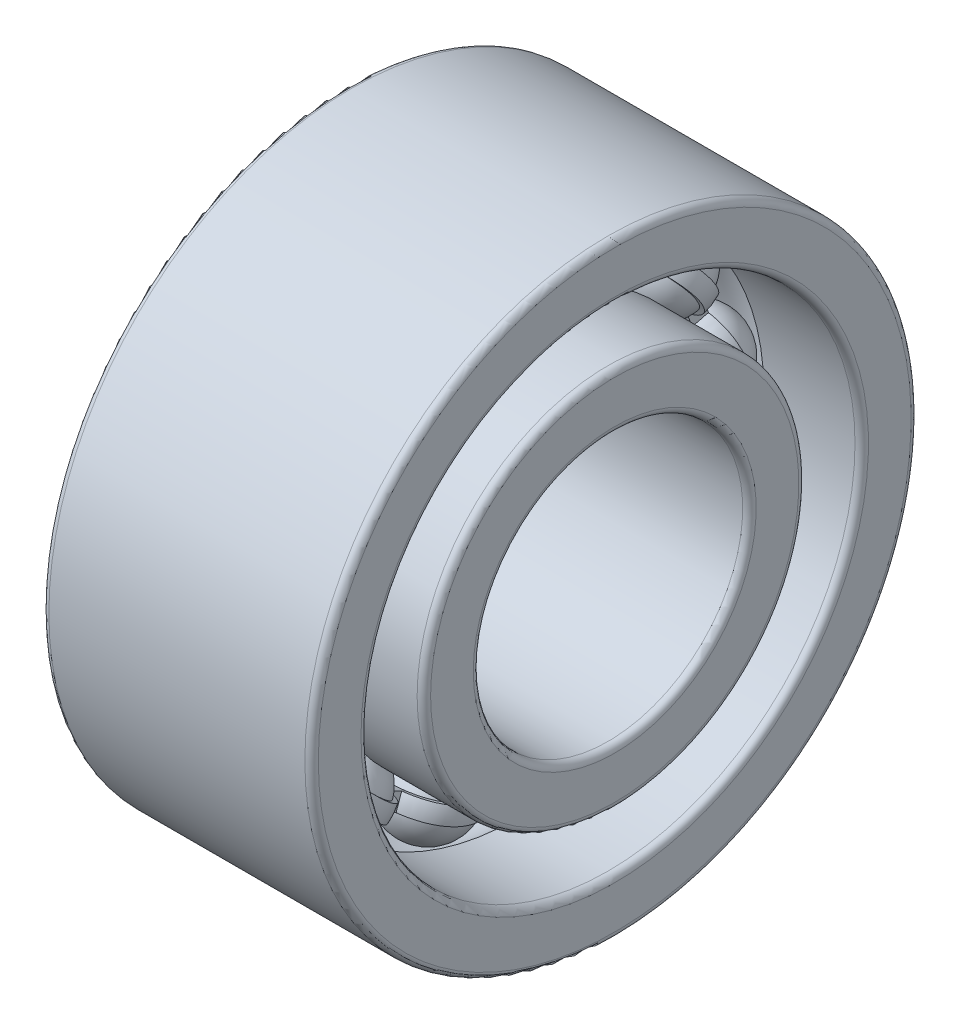
from build123d import *
from build123d.topology import SkipClean

# Parameters (mm, degrees)
SKETCH_5_W               = 0.375
SKETCH_5_H               = 0.25
PATTERN_CIRCULAR_5_COUNT = 13
PATTERN_CIRCULAR_2_COUNT = 13


with BuildPart() as part:
    # 草图2 → 旋转1 (revolve)
    with BuildSketch(Plane.XY, mode=Mode.PRIVATE) as revolve_1_sk:
        with BuildLine():
            Line((1.9, 2), (-1.9, 2))
            ThreePointArc((-1.9, 2), (-1.970710678, 2.029289322), (-2, 2.1))
            Line((-2, 2.1), (-2, 2.733333333))
            ThreePointArc((-2, 2.733333333), (-1.970710678, 2.804044011), (-1.9, 2.833333333))
            Line((-1.9, 2.833333333), (-0.465847495, 2.833333333))
            ThreePointArc((-0.465847495, 2.833333333), (0, 2.625), (0.465847495, 2.833333333))
            Line((0.465847495, 2.833333333), (1.9, 2.833333333))
            ThreePointArc((1.9, 2.833333333), (1.970710678, 2.804044011), (2, 2.733333333))
            Line((2, 2.733333333), (2, 2.1))
            ThreePointArc((2, 2.1), (1.970710678, 2.029289322), (1.9, 2))
        make_face()
        with BuildLine():
            Line((-2, 4.4), (-2, 3.766666667))
            ThreePointArc((-2, 3.766666667), (-1.970710678, 3.695955989), (-1.9, 3.666666667))
            Line((-1.9, 3.666666667), (-0.465847495, 3.666666667))
            ThreePointArc((-0.465847495, 3.666666667), (0, 3.875), (0.465847495, 3.666666667))
            Line((0.465847495, 3.666666667), (1.9, 3.666666667))
            ThreePointArc((1.9, 3.666666667), (1.970710678, 3.695955989), (2, 3.766666667))
            Line((2, 3.766666667), (2, 4.4))
            ThreePointArc((2, 4.4), (1.970710678, 4.470710678), (1.9, 4.5))
            Line((1.9, 4.5), (-1.9, 4.5))
            ThreePointArc((-1.9, 4.5), (-1.970710678, 4.470710678), (-2, 4.4))
        make_face()
    revolve(revolve_1_sk.sketch.rotate(Axis((-3.5, 0, 0), (1, 0, 0)), 90), axis=Axis((-3.5, 0, 0), (1, 0, 0)))


with BuildPart() as body_2:
    # 草图5 → 旋转3 (revolve)
    with BuildSketch(Plane.XY, mode=Mode.PRIVATE) as revolve_3_sk:
        with Locations((0, 3.25)):
            Rectangle(SKETCH_5_W, SKETCH_5_H)
    revolve(revolve_3_sk.sketch.rotate(Axis((-19.927092192, 0, 0), (1, 0, 0)), 90), axis=Axis((-19.927092192, 0, 0), (1, 0, 0)))



with BuildPart() as body_3:
    # 草图3 → 旋转2 (revolve)
    with BuildSketch(Plane.XY):
        with BuildLine():
            Line((-0.6875, 3.25), (0.6875, 3.25))
            ThreePointArc((0.6875, 3.25), (0, 3.9375), (-0.6875, 3.25))
        make_face()
    revolve(axis=Axis((-0.6875, 3.25, 0), (1, 0, 0)))


with BuildPart() as pattern_circular_5_1:
    # 阵列(圆周)5: pattern copy
    add(body_3.part.rotate(Axis((0, 0, 0), (1, 0, 0)), 1 * 360 / PATTERN_CIRCULAR_5_COUNT))


with BuildPart() as pattern_circular_5_2:
    # 阵列(圆周)5: pattern copy
    add(body_3.part.rotate(Axis((0, 0, 0), (1, 0, 0)), 2 * 360 / PATTERN_CIRCULAR_5_COUNT))


with BuildPart() as pattern_circular_5_3:
    # 阵列(圆周)5: pattern copy
    add(body_3.part.rotate(Axis((0, 0, 0), (1, 0, 0)), 3 * 360 / PATTERN_CIRCULAR_5_COUNT))


with BuildPart() as pattern_circular_5_4:
    # 阵列(圆周)5: pattern copy
    add(body_3.part.rotate(Axis((0, 0, 0), (1, 0, 0)), 4 * 360 / PATTERN_CIRCULAR_5_COUNT))


with BuildPart() as pattern_circular_5_5:
    # 阵列(圆周)5: pattern copy
    add(body_3.part.rotate(Axis((0, 0, 0), (1, 0, 0)), 5 * 360 / PATTERN_CIRCULAR_5_COUNT))


with BuildPart() as pattern_circular_5_6:
    # 阵列(圆周)5: pattern copy
    add(body_3.part.rotate(Axis((0, 0, 0), (1, 0, 0)), 6 * 360 / PATTERN_CIRCULAR_5_COUNT))


with BuildPart() as pattern_circular_5_7:
    # 阵列(圆周)5: pattern copy
    add(body_3.part.rotate(Axis((0, 0, 0), (1, 0, 0)), 7 * 360 / PATTERN_CIRCULAR_5_COUNT))


with BuildPart() as pattern_circular_5_8:
    # 阵列(圆周)5: pattern copy
    add(body_3.part.rotate(Axis((0, 0, 0), (1, 0, 0)), 8 * 360 / PATTERN_CIRCULAR_5_COUNT))


with BuildPart() as pattern_circular_5_9:
    # 阵列(圆周)5: pattern copy
    add(body_3.part.rotate(Axis((0, 0, 0), (1, 0, 0)), 9 * 360 / PATTERN_CIRCULAR_5_COUNT))


with BuildPart() as pattern_circular_5_10:
    # 阵列(圆周)5: pattern copy
    add(body_3.part.rotate(Axis((0, 0, 0), (1, 0, 0)), 10 * 360 / PATTERN_CIRCULAR_5_COUNT))


with BuildPart() as pattern_circular_5_11:
    # 阵列(圆周)5: pattern copy
    add(body_3.part.rotate(Axis((0, 0, 0), (1, 0, 0)), 11 * 360 / PATTERN_CIRCULAR_5_COUNT))


with BuildPart() as pattern_circular_5_12:
    # 阵列(圆周)5: pattern copy
    add(body_3.part.rotate(Axis((0, 0, 0), (1, 0, 0)), 12 * 360 / PATTERN_CIRCULAR_5_COUNT))


with BuildPart() as cut_revolve_1_tool:
    # 草图6 → 切除-旋转1 (revolve)
    with BuildSketch(Plane.XY):
        with BuildLine():
            Line((-0.676040864, 3.375), (0.676040864, 3.375))
            ThreePointArc((0.676040864, 3.375), (0, 3.9375), (-0.676040864, 3.375))
        make_face()
        with BuildLine():
            Line((-0.676040864, 3.125), (0.676040864, 3.125))
            ThreePointArc((0.676040864, 3.125), (0, 2.5625), (-0.676040864, 3.125))
        make_face()
    revolve(axis=Axis((-19.927092192, 0, 0), (1, 0, 0)))


with BuildPart() as part_1:
    add(part.part)

    # 切除-旋转1: cut by cut_revolve_1_tool
    add(cut_revolve_1_tool.part, mode=Mode.SUBTRACT)


with BuildPart() as body_3_1:
    add(body_3.part)

    # 切除-旋转1: cut by cut_revolve_1_tool
    add(cut_revolve_1_tool.part, mode=Mode.SUBTRACT)


with BuildPart() as pattern_circular_5_1_1:
    add(pattern_circular_5_1.part)

    # 切除-旋转1: cut by cut_revolve_1_tool
    add(cut_revolve_1_tool.part, mode=Mode.SUBTRACT)


with BuildPart() as pattern_circular_5_2_1:
    add(pattern_circular_5_2.part)

    # 切除-旋转1: cut by cut_revolve_1_tool
    add(cut_revolve_1_tool.part, mode=Mode.SUBTRACT)


with BuildPart() as pattern_circular_5_3_1:
    add(pattern_circular_5_3.part)

    # 切除-旋转1: cut by cut_revolve_1_tool
    add(cut_revolve_1_tool.part, mode=Mode.SUBTRACT)


with BuildPart() as pattern_circular_5_4_1:
    add(pattern_circular_5_4.part)

    # 切除-旋转1: cut by cut_revolve_1_tool
    add(cut_revolve_1_tool.part, mode=Mode.SUBTRACT)


with BuildPart() as pattern_circular_5_5_1:
    add(pattern_circular_5_5.part)

    # 切除-旋转1: cut by cut_revolve_1_tool
    add(cut_revolve_1_tool.part, mode=Mode.SUBTRACT)


with BuildPart() as pattern_circular_5_6_1:
    add(pattern_circular_5_6.part)

    # 切除-旋转1: cut by cut_revolve_1_tool
    add(cut_revolve_1_tool.part, mode=Mode.SUBTRACT)


with BuildPart() as pattern_circular_5_7_1:
    add(pattern_circular_5_7.part)

    # 切除-旋转1: cut by cut_revolve_1_tool
    add(cut_revolve_1_tool.part, mode=Mode.SUBTRACT)


with BuildPart() as pattern_circular_5_8_1:
    add(pattern_circular_5_8.part)

    # 切除-旋转1: cut by cut_revolve_1_tool
    add(cut_revolve_1_tool.part, mode=Mode.SUBTRACT)


with BuildPart() as pattern_circular_5_9_1:
    add(pattern_circular_5_9.part)

    # 切除-旋转1: cut by cut_revolve_1_tool
    add(cut_revolve_1_tool.part, mode=Mode.SUBTRACT)


with BuildPart() as pattern_circular_5_10_1:
    add(pattern_circular_5_10.part)

    # 切除-旋转1: cut by cut_revolve_1_tool
    add(cut_revolve_1_tool.part, mode=Mode.SUBTRACT)


with BuildPart() as pattern_circular_5_11_1:
    add(pattern_circular_5_11.part)

    # 切除-旋转1: cut by cut_revolve_1_tool
    add(cut_revolve_1_tool.part, mode=Mode.SUBTRACT)


with BuildPart() as pattern_circular_5_12_1:
    add(pattern_circular_5_12.part)

    # 切除-旋转1: cut by cut_revolve_1_tool
    add(cut_revolve_1_tool.part, mode=Mode.SUBTRACT)


with BuildPart() as body_2_1:
    with SkipClean():  # the faces are left unmerged after this step: merging them gives an invalid solid
        add(body_2.part)

        add(body_3_1.part)  # 旋转4 merges body 3
        # 草图7 → 旋转4 (revolve)
        with BuildSketch(Plane.XY):
            with BuildLine():
                Line((-0.625, 3.25), (0.625, 3.25))
                ThreePointArc((0.625, 3.25), (0, 3.875), (-0.625, 3.25))
            make_face()
        revolve_4 = revolve(axis=Axis((-0.625, 3.25, 0), (1, 0, 0)))

    # 阵列(圆周)2: 旋转4 ×13 about axis
    pattern_circular_2_axis = Axis((0, 0, 0), (1, 0, 0))
    for i in range(1, PATTERN_CIRCULAR_2_COUNT):
        add(revolve_4.rotate(pattern_circular_2_axis, i * 360 / PATTERN_CIRCULAR_2_COUNT))


solid = Compound([part_1.part, pattern_circular_5_1_1.part, pattern_circular_5_2_1.part, pattern_circular_5_3_1.part, pattern_circular_5_4_1.part, pattern_circular_5_5_1.part, pattern_circular_5_6_1.part, pattern_circular_5_7_1.part, pattern_circular_5_8_1.part, pattern_circular_5_9_1.part, pattern_circular_5_10_1.part, pattern_circular_5_11_1.part, pattern_circular_5_12_1.part, body_2_1.part])
